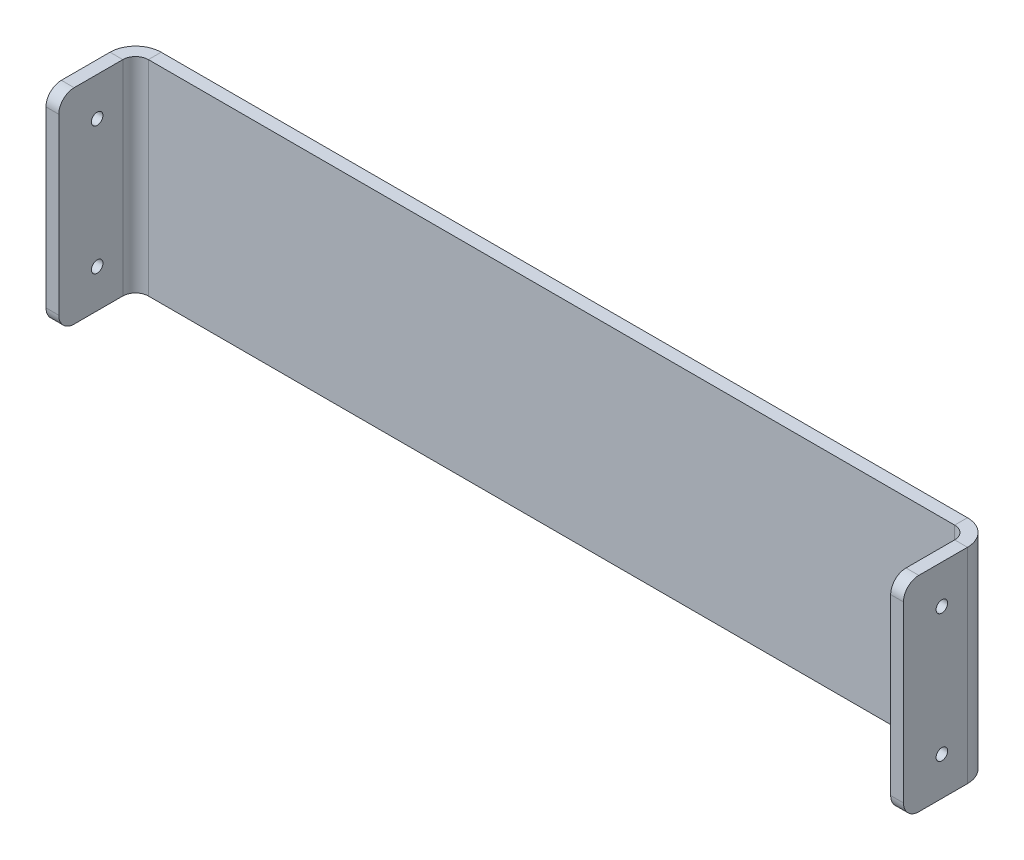
from build123d import *

# Parameters (mm, degrees)
ESQUISSE1_W                  = 335
ESQUISSE1_H                  = 80
BOSS_EXTRU_1_DEPTH           = 5
ESQUISSE2_W                  = 5
ESQUISSE2_H                  = 80
BOSS_EXTRU_2_DEPTH           = 30
ENL_V_MAT_EXTRU_1_DEPTH      = 347.193587462
ENL_V_MAT_EXTRU_1_DEPTH_BACK = 347.193587462
ESQUISSE3_R                  = 2.25
CONG_1_R                     = 6
CONVERTIR_VOLUME2_DEPTH      = 80
CONVERTIR_VOLUME2_2_DEPTH    = 80


# Read off the part's stored shape, not the designer's step: Convertir-Volume2
with BuildPart() as part:
    # Esquisse1 → Boss.-Extru.1 (new body)
    with BuildSketch(Plane.XY):
        with Locations((167.5, 40)):
            Rectangle(ESQUISSE1_W, ESQUISSE1_H)
    extrude(amount=BOSS_EXTRU_1_DEPTH)

    # Esquisse2 → Boss.-Extru.2 (add)
    with BuildSketch(Plane.XY.offset(5)):
        with Locations((2.5, 40)):
            Rectangle(ESQUISSE2_W, ESQUISSE2_H)
        with Locations((332.5, 40)):
            Rectangle(ESQUISSE2_W, ESQUISSE2_H)
    extrude(amount=BOSS_EXTRU_2_DEPTH)

    # Esquisse3 → Enlèv. mat.-Extru.1 (cut, two sides: drawn at the far end of the back side and taken through both)
    with BuildSketch(Plane.ZY.offset(-ENL_V_MAT_EXTRU_1_DEPTH_BACK)):
        with Locations((20, 15)):
            Circle(ESQUISSE3_R)
        with Locations(Location((20, 65, 0), (0, 0, 180))):
            Circle(ESQUISSE3_R)
    extrude(amount=ENL_V_MAT_EXTRU_1_DEPTH + ENL_V_MAT_EXTRU_1_DEPTH_BACK, mode=Mode.SUBTRACT)

    # Congé1
    cong_1_edges = [part.edges().sort_by_distance(p)[0] for p in [
        (2.5, 0, 35),
        (2.5, 80, 35),
        (332.5, 0, 35),
        (332.5, 80, 35),
    ]]
    fillet(cong_1_edges, radius=CONG_1_R)

    # Convertir-Volume2 outline → Convertir-Volume2 (cut)
    with BuildSketch(Plane(origin=(0, 0, 0), x_dir=(1, 0, 0), z_dir=(0, 1, 0))):
        with BuildLine():
            ThreePointArc((0, -10), (2.928932188, -2.928932188), (10, 0))
            Line((10, 0), (0, 0))
            Line((0, 0), (0, -10))
        make_face()
        with BuildLine():
            ThreePointArc((325, 0), (332.071067812, -2.928932188), (335, -10))
            Line((335, -10), (335, 0))
            Line((335, 0), (325, 0))
        make_face()
    extrude(amount=CONVERTIR_VOLUME2_DEPTH, mode=Mode.SUBTRACT)

    # Convertir-Volume2 2 outline → Convertir-Volume2 2 (add)
    with BuildSketch(Plane(origin=(0, 0, 0), x_dir=(1, 0, 0), z_dir=(0, 1, 0))):
        with BuildLine():
            ThreePointArc((5, -10), (6.464466094, -6.464466094), (10, -5))
            Line((10, -5), (5, -5))
            Line((5, -5), (5, -10))
        make_face()
        with BuildLine():
            ThreePointArc((325, -5), (328.535533906, -6.464466094), (330, -10))
            Line((330, -10), (330, -5))
            Line((330, -5), (325, -5))
        make_face()
    extrude(amount=CONVERTIR_VOLUME2_2_DEPTH)


solid = part.part
